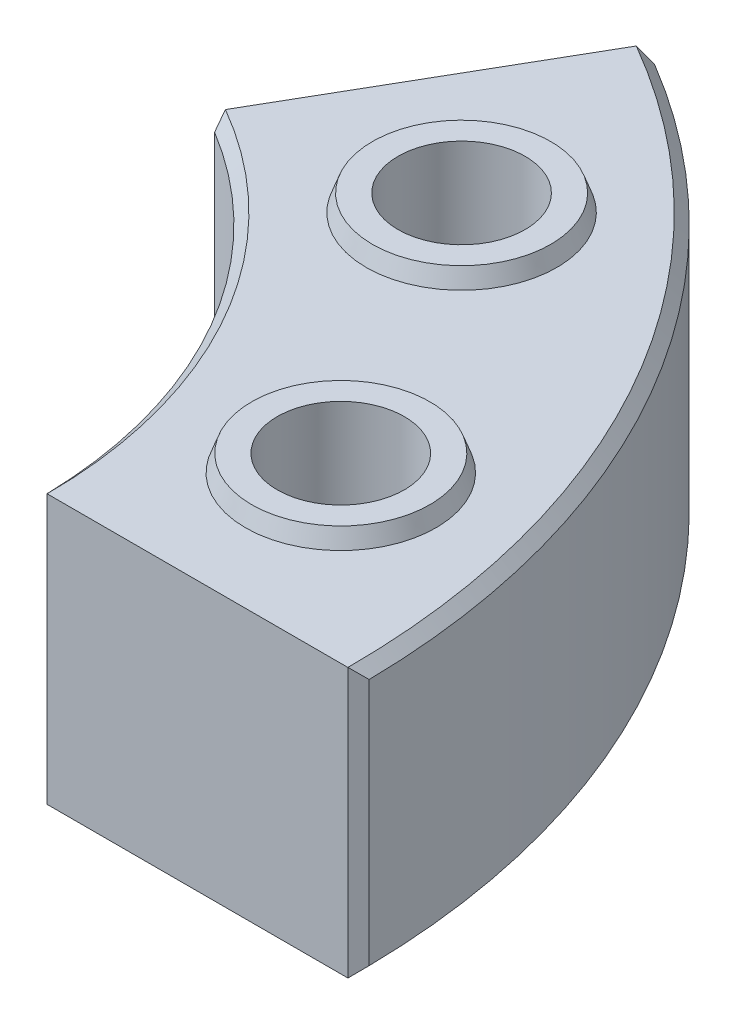
from build123d import *
from OCP.BRepFilletAPI import BRepFilletAPI_MakeChamfer

# Parameters (mm, degrees)
SKETCH1_R           = 30
BOSS_EXTRUDE1_DEPTH = 127
BOSS_EXTRUDE2_START = 8
SKETCH2_R           = 45
SKETCH2_R_2         = 30
BOSS_EXTRUDE2_DEPTH = 8
CHAMFER1_SIZE       = 2.911761874
CHAMFER1_SIZE_2     = 8
CUT_EXTRUDE1_START  = -10
SKETCH3_R           = 46
SKETCH3_R_2         = 30
CUT_EXTRUDE1_DEPTH  = 10
CHAMFER2_SIZE       = 3.639702343
CHAMFER2_SIZE_2     = 10


# Some blends are built 0.0001 mm under size
with BuildPart() as part:
    # Sketch1 → Boss-Extrude1 (new body)
    with BuildSketch(Plane(origin=(0, 0, 0), x_dir=(1, 0, 0), z_dir=(0, 1, 0))):
        with BuildLine():
            Line((225, 0), (377, 0))
            ThreePointArc((377, 0), (326.491577227, 188.5), (188.5, 326.491577227))
            Line((188.5, 326.491577227), (112.5, 194.855715852))
            ThreePointArc((112.5, 194.855715852), (194.855715851, 112.5), (225, 0))
        make_face()
        with Locations(Location((212.839141137, 212.839141137, 0), (0, 0, 270))):
            Circle(SKETCH1_R, mode=Mode.SUBTRACT)
        with Locations(Location((290.743673713, 77.904532576, 0), (0, 0, 270))):
            Circle(SKETCH1_R, mode=Mode.SUBTRACT)
    extrude(amount=-BOSS_EXTRUDE1_DEPTH)

    # Sketch2 → Boss-Extrude2 (add)
    # profile 1 of 2: a face of its own
    with BuildSketch(Plane(origin=(0, 0, 0), x_dir=(1, 0, 0), z_dir=(0, 1, 0)).offset(BOSS_EXTRUDE2_START)):
        with Locations(Location((212.839141137, 212.839141137, 0), (0, 0, 270))):
            Circle(SKETCH2_R)
        with Locations(Location((212.839141137, 212.839141137, 0), (0, 0, 270))):
            Circle(SKETCH2_R_2, mode=Mode.SUBTRACT)
    # profile 2 of 2: a face of its own
    with BuildSketch(Plane(origin=(0, 0, 0), x_dir=(1, 0, 0), z_dir=(0, 1, 0)).offset(BOSS_EXTRUDE2_START)):
        with Locations(Location((290.743673713, 77.904532576, 0), (0, 0, 270))):
            Circle(SKETCH2_R)
        with Locations(Location((290.743673713, 77.904532576, 0), (0, 0, 270))):
            Circle(SKETCH2_R_2, mode=Mode.SUBTRACT)
    extrude(amount=-BOSS_EXTRUDE2_DEPTH)

    # Chamfer1
    chamfer1_edges_1 = [part.edges().sort_by_distance(p)[0] for p in [
        (212.839141137, 8, -257.839141137),
    ]]
    chamfer1_side_1 = [part.faces().sort_by_distance(p)[0] for p in [
        (212.839141137, 8, -257.7809059),
    ]]
    chamfer1_edges_2 = [part.edges().sort_by_distance(p)[0] for p in [
        (290.743673713, 8, -122.904532576),
    ]]
    chamfer1_side_2 = [part.faces().sort_by_distance(p)[0] for p in [
        (290.743673713, 8, -122.846297338),
    ]]
    chamfer1 = BRepFilletAPI_MakeChamfer(part.part.solid().wrapped)
    for e in chamfer1_edges_1:
        chamfer1.Add(CHAMFER1_SIZE - 0.0001, CHAMFER1_SIZE_2 - 0.0001, e.wrapped, chamfer1_side_1[0].wrapped)
    for e in chamfer1_edges_2:
        chamfer1.Add(CHAMFER1_SIZE - 0.0001, CHAMFER1_SIZE_2 - 0.0001, e.wrapped, chamfer1_side_2[0].wrapped)
    add(Compound.cast(chamfer1.Shape()), mode=Mode.REPLACE)  # a hair under: the kernel refuses the full size

    # Sketch3 → Cut-Extrude1 (cut)
    # profile 1 of 2: a face of its own
    with BuildSketch(Plane.XZ.offset(127).offset(CUT_EXTRUDE1_START)):
        with Locations(Location((290.743673713, -77.904532576, 0), (0, 0, 270))):
            Circle(SKETCH3_R)
        with Locations(Location((290.743673713, -77.904532576, 0), (0, 0, 90))):
            Circle(SKETCH3_R_2, mode=Mode.SUBTRACT)
    # profile 2 of 2: a face of its own
    with BuildSketch(Plane.XZ.offset(127).offset(CUT_EXTRUDE1_START)):
        with Locations(Location((212.839141137, -212.839141137, 0), (0, 0, 270))):
            Circle(SKETCH3_R)
        with Locations(Location((212.839141137, -212.839141137, 0), (0, 0, 90))):
            Circle(SKETCH3_R_2, mode=Mode.SUBTRACT)
    extrude(amount=CUT_EXTRUDE1_DEPTH, mode=Mode.SUBTRACT)

    # Chamfer2
    chamfer2_edges_1 = [part.edges().sort_by_distance(p)[0] for p in [
        (290.743673713, -117, -31.904532576),
    ]]
    chamfer2_side_1 = [part.faces().sort_by_distance(p)[0] for p in [
        (290.743673713, -117, -31.977326623),
    ]]
    chamfer2_edges_2 = [part.edges().sort_by_distance(p)[0] for p in [
        (212.839141137, -117, -166.839141137),
    ]]
    chamfer2_side_2 = [part.faces().sort_by_distance(p)[0] for p in [
        (212.839141137, -117.072794047, -166.839141137),
    ]]
    chamfer2 = BRepFilletAPI_MakeChamfer(part.part.solid().wrapped)
    for e in chamfer2_edges_1:
        chamfer2.Add(CHAMFER2_SIZE - 0.0001, CHAMFER2_SIZE_2 - 0.0001, e.wrapped, chamfer2_side_1[0].wrapped)
    for e in chamfer2_edges_2:
        chamfer2.Add(CHAMFER2_SIZE_2 - 0.0001, CHAMFER2_SIZE - 0.0001, e.wrapped, chamfer2_side_2[0].wrapped)
    add(Compound.cast(chamfer2.Shape()), mode=Mode.REPLACE)  # a hair under: the kernel refuses the full size

    # Chamfer3
    # the kernel refuses this chamfer: 5 mm, written as the material it takes off along each edge
    with BuildSketch(Plane(origin=(0, -127, 0), x_dir=(0.9994181981512107, 0, 0.03410667389511293), z_dir=(-0.03410667389511293, 0, 0.9994181981512107))) as chamfer3_piece_1:
        with BuildLine():
            Line((371.858578644, -0.141421356), (377.141421356, 5.141421356))
            Line((377.141421356, 5.141421356), (377.241421356, 5.141421356))
            ThreePointArc((377.241421356, 5.141421356), (377.1, 2.570710678), (377.1, 0))
            Line((377.1, 0), (377, -0.1))
            ThreePointArc((377, -0.1), (374.429289322, -0.1), (371.858578644, -0.241421356))
            Line((371.858578644, -0.241421356), (371.858578644, -0.141421356))
        make_face()
    revolve(axis=Axis((0, -127, 0), (0, 1, 0)), revolution_arc=63.90909507, mode=Mode.SUBTRACT)
    with BuildSketch(Plane(origin=(0, -127, 0), x_dir=(0.4497094956032867, 0, -0.8931748818480272), z_dir=(-0.8931748818480272, 0, -0.4497094956032867))) as chamfer3_piece_2:
        with BuildLine():
            Line((230.141421356, 0.141421356), (224.858578644, -5.141421356))
            Line((224.858578644, -5.141421356), (224.758578644, -5.141421356))
            ThreePointArc((224.758578644, -5.141421356), (224.9, -2.570710678), (224.9, 0))
            Line((224.9, 0), (225, 0.1))
            ThreePointArc((225, 0.1), (227.570710678, 0.1), (230.141421356, 0.241421356))
            Line((230.141421356, 0.241421356), (230.141421356, 0.141421356))
        make_face()
    revolve(axis=Axis((0, -127, 0), (0, -1, 0)), revolution_arc=66.549905963, mode=Mode.SUBTRACT)
    with BuildSketch(Plane(origin=(0, 0, 0), x_dir=(0.9994181981512107, 0, 0.03410667389511288), z_dir=(-0.03410667389511288, 0, 0.9994181981512107))) as chamfer3_piece_3:
        with BuildLine():
            Line((377.141421356, -5.141421356), (371.858578644, 0.141421356))
            Line((371.858578644, 0.141421356), (371.858578644, 0.241421356))
            ThreePointArc((371.858578644, 0.241421356), (374.429289322, 0.1), (377, 0.1))
            Line((377, 0.1), (377.1, 0))
            ThreePointArc((377.1, 0), (377.1, -2.570710678), (377.241421356, -5.141421356))
            Line((377.241421356, -5.141421356), (377.141421356, -5.141421356))
        make_face()
    revolve(axis=Axis((0, 0, 0), (0, 1, 0)), revolution_arc=63.90909507, mode=Mode.SUBTRACT)
    with BuildSketch(Plane(origin=(0, 0, 0), x_dir=(0.4497094956032867, 0, -0.8931748818480272), z_dir=(-0.8931748818480272, 0, -0.4497094956032867))) as chamfer3_piece_4:
        with BuildLine():
            Line((224.858578644, 5.141421356), (230.141421356, -0.141421356))
            Line((230.141421356, -0.141421356), (230.141421356, -0.241421356))
            ThreePointArc((230.141421356, -0.241421356), (227.570710678, -0.1), (225, -0.1))
            Line((225, -0.1), (224.9, 0))
            ThreePointArc((224.9, 0), (224.9, 2.570710678), (224.758578644, 5.141421356))
            Line((224.758578644, 5.141421356), (224.858578644, 5.141421356))
        make_face()
    revolve(axis=Axis((0, 0, 0), (0, -1, 0)), revolution_arc=66.549905963, mode=Mode.SUBTRACT)
    with BuildSketch(Plane(origin=(112.5, 12.726295315, -194.855715852), x_dir=(0.4760148236193062, 0, -0.8794372562580466), z_dir=(0, -1, 0))) as chamfer3_piece_5:
        with BuildLine():
            Line((5.090518126, 0), (-0.33429411, 5.023891374))
            Line((-0.33429411, 5.023891374), (-0.434172994, 5.018971161))
            ThreePointArc((-0.434172994, 5.018971161), (-0.183141977, 2.511326919), (-0.099962242, -0.00274777))
            Line((-0.099962242, -0.00274777), (0.00274777, -0.099962242))
            ThreePointArc((0.00274777, -0.099962242), (2.546085101, -0.030050788), (5.093265896, -0.099962242))
            Line((5.093265896, -0.099962242), (5.090518126, 0))
        make_face()
    extrude(amount=152.452590629, mode=Mode.SUBTRACT)
    with BuildSketch(Plane(origin=(188.5, 13.026648977, -326.491577227), x_dir=(-0.5236311743551006, 0, 0.8519450646863905), z_dir=(0, -1, 0))) as chamfer3_piece_6:
        with BuildLine():
            Line((5.176029718, 0), (-0.249663351, -5.204674974))
            Line((-0.249663351, -5.204674974), (-0.349653457, -5.203268263))
            ThreePointArc((-0.349653457, -5.203268263), (-0.162620276, -2.601558906), (-0.099962166, 0.002750537))
            Line((-0.099962166, 0.002750537), (0.002750537, 0.099962166))
            ThreePointArc((0.002750537, 0.099962166), (2.588807445, 0.0288048), (5.178780254, 0.099962166))
            Line((5.178780254, 0.099962166), (5.176029718, 0))
        make_face()
    extrude(amount=153.053297954, mode=Mode.SUBTRACT)
    with BuildSketch(Plane(origin=(377, 13.026648977, 0), x_dir=(0.02042205911014994, 0, -0.9997914480038833), z_dir=(0, -1, 0))) as chamfer3_piece_7:
        with BuildLine():
            Line((5.210659591, 0), (-0.248004097, -5.170084874))
            Line((-0.248004097, -5.170084874), (-0.347983242, -5.168042668))
            ThreePointArc((-0.347983242, -5.168042668), (-0.152811741, -2.584453961), (-0.099979145, 0.002042206))
            Line((-0.099979145, 0.002042206), (0.002042206, 0.099979145))
            ThreePointArc((0.002042206, 0.099979145), (2.60636271, 0.037782504), (5.214045418, 0.099942664))
            Line((5.214045418, 0.099942664), (5.210659591, 0))
        make_face()
    extrude(amount=153.053297954, mode=Mode.SUBTRACT)
    with BuildSketch(Plane(origin=(225, 12.726295315, 0), x_dir=(-0.03895191023079492, 0, -0.999241086369737), z_dir=(0, -1, 0))) as chamfer3_piece_8:
        with BuildLine():
            Line((5.0350012, 0), (-0.337980103, 5.0792858))
            Line((-0.337980103, 5.0792858), (-0.437904212, 5.075390609))
            ThreePointArc((-0.437904212, 5.075390609), (-0.199029377, 2.538471922), (-0.099924109, -0.003895191))
            Line((-0.099924109, -0.003895191), (0.003895191, -0.099924109))
            ThreePointArc((0.003895191, -0.099924109), (2.517945165, -0.016000711), (5.036723207, -0.099985172))
            Line((5.036723207, -0.099985172), (5.0350012, 0))
        make_face()
    extrude(amount=152.452590629, mode=Mode.SUBTRACT)


solid = part.part
